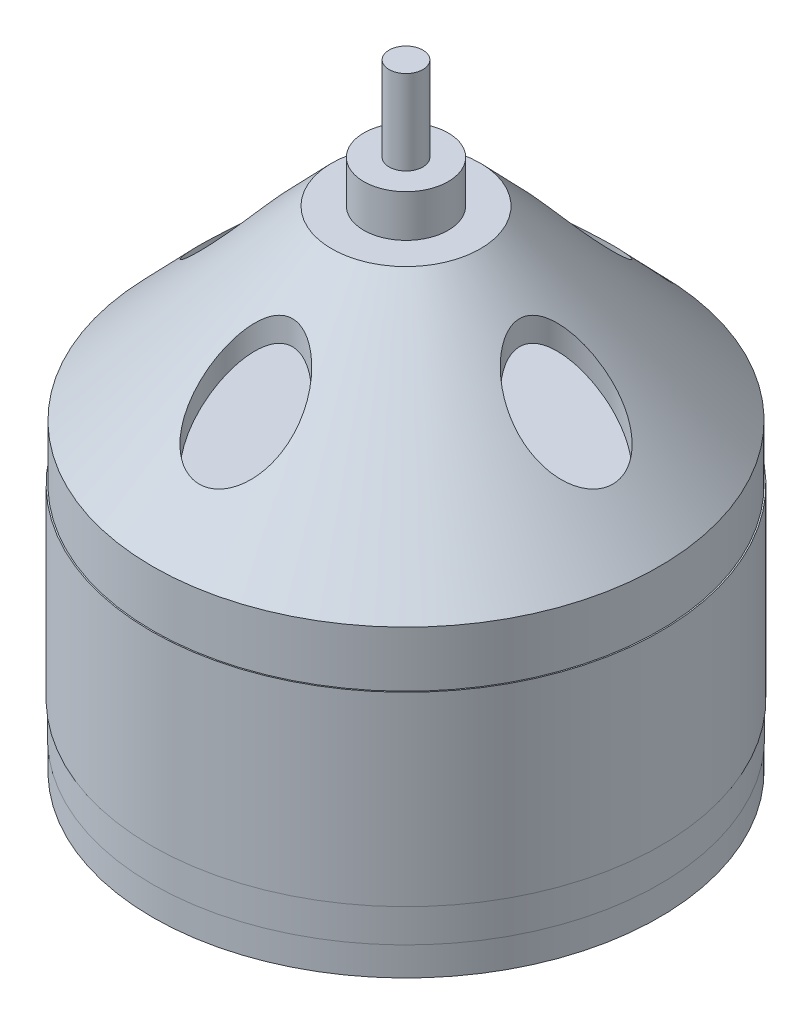
from build123d import *

# Parameters (mm, degrees)
CROQUIS3_R              = 2.5
SALIENTE_EXTRUIR1_DEPTH = 2.5
CROQUIS4_R              = 1
SALIENTE_EXTRUIR2_DEPTH = 5
CROQUIS6_R              = 2.760916645
CORTAR_EXTRUIR1_DEPTH   = 35
SALIENTE_EXTRUIR3_START = -1
CROQUIS7_R              = 14
SALIENTE_EXTRUIR3_DEPTH = 1
CROQUIS8_R              = 15.075481364
SALIENTE_EXTRUIR4_DEPTH = 5.5
CROQUIS9_R              = 15.022760534
SALIENTE_EXTRUIR5_DEPTH = 2


# Read off the part's stored shape, not the designer's step: Vaciado1
with BuildPart() as part:
    # Croquis2 → Revolución1 (revolve)
    with BuildSketch(Plane(origin=(0, 0, 0), x_dir=(0, 0, -1), z_dir=(1, 0, 0))):
        Polygon((0, -9.212888184), (15, -9.212888184), (15, 8.787111816), (4.400455902, 19.788614132), (0, 19.788614132), align=None)
    revolve(axis=Axis((0, -10.664729222, 0), (0, 1, 0)))

    # Croquis3 → Saliente-Extruir1 (add)
    with BuildSketch(Plane(origin=(0, 19.788614132, 0), x_dir=(1, 0, 0), z_dir=(0, 1, 0))):
        with Locations(Location((0, 0, 0), (0, 0, 270))):
            Circle(CROQUIS3_R)
    extrude(amount=SALIENTE_EXTRUIR1_DEPTH)

    # Croquis4 → Saliente-Extruir2 (add)
    with BuildSketch(Plane(origin=(0, 22.288614132, 0), x_dir=(1, 0, 0), z_dir=(0, 1, 0))):
        with Locations(Location((0, 0, 0), (0, 0, 270))):
            Circle(CROQUIS4_R)
    extrude(amount=SALIENTE_EXTRUIR2_DEPTH)

    # Vaciado1 outline → Vaciado1 (revolve, cut)
    with BuildSketch(Plane.XY):
        Polygon((14, -9.212888184), (14, 8.383755945), (3.975300644, 18.788614132), (1.5, 18.788614132), (1.5, 21.288614132), (0, 21.288614132), (0, -9.212888184), align=None)
    revolve(axis=Axis((0, 0, 0), (0, 1, 0)), mode=Mode.SUBTRACT)

    # Croquis6 → Cortar-Extruir1 (cut)
    with BuildSketch(Plane(origin=(0, 19.788614132, 0), x_dir=(1, 0, 0), z_dir=(0, 1, 0))):
        with Locations(Location((0, -9.487911963, 0), (0, 0, 168.367798153))):
            Circle(CROQUIS6_R)
        with Locations(Location((-9.487911963, 0, 0), (0, 0, 155.446542586))):
            Circle(CROQUIS6_R)
        with Locations(Location((0, 9.487911963, 0), (0, 0, 270.000000733))):
            Circle(CROQUIS6_R)
        with Locations(Location((9.487911963, 0, 0), (0, 0, 99.378357768))):
            Circle(CROQUIS6_R)
    extrude(amount=-CORTAR_EXTRUIR1_DEPTH, mode=Mode.SUBTRACT)

    # Croquis7 → Saliente-Extruir3 (add)
    with BuildSketch(Plane.XZ.offset(9.212888184).offset(SALIENTE_EXTRUIR3_START)):
        with Locations(Location((0, 0, 0), (0, 0, 270))):
            Circle(CROQUIS7_R)
    extrude(amount=SALIENTE_EXTRUIR3_DEPTH)

    # Croquis8 → Saliente-Extruir4 (add, symmetric)
    with BuildSketch(Plane(origin=(0, 0, 0), x_dir=(1, 0, 0), z_dir=(0, 1, 0))):
        with Locations(Location((0, 0, 0), (0, 0, 270))):
            Circle(CROQUIS8_R)
    extrude(amount=SALIENTE_EXTRUIR4_DEPTH, both=True)

    # Croquis9 → Saliente-Extruir5 (add)
    with BuildSketch(Plane.XZ.offset(5.5)):
        with Locations(Location((0, 0, 0), (0, 0, 90))):
            Circle(CROQUIS9_R)
    extrude(amount=SALIENTE_EXTRUIR5_DEPTH)


solid = part.part
